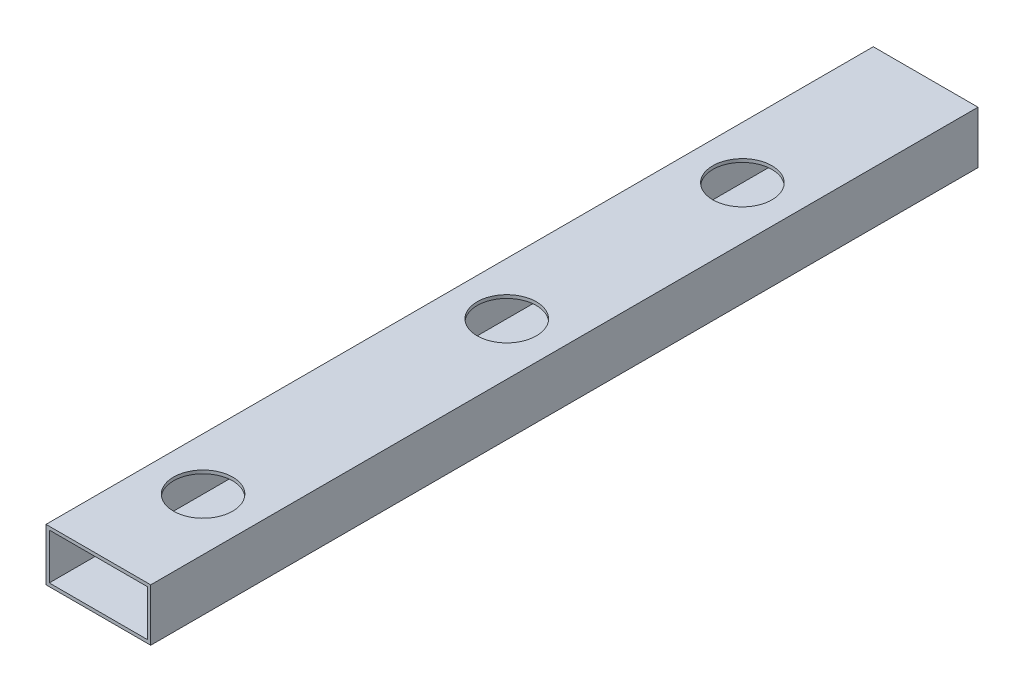
from build123d import *

# Parameters (mm, degrees)
SKETCH1_W           = 50.8
SKETCH1_H           = 25.4
SKETCH1_W_2         = 47.625
SKETCH1_H_2         = 22.225
BOSS_EXTRUDE1_DEPTH = 401.32
SKETCH2_R           = 14.351
CUT_EXTRUDE1_DEPTH  = 406.319062468
SKETCH3_R           = 14.351
CUT_EXTRUDE2_DEPTH  = 406.319062468


with BuildPart() as part:
    # Sketch1 → Boss-Extrude1 (new body)
    with BuildSketch(Plane.XY):
        with Locations((25.4, 12.7)):
            Rectangle(SKETCH1_W, SKETCH1_H)
        with Locations((25.4, 12.7)):
            Rectangle(SKETCH1_W_2, SKETCH1_H_2, mode=Mode.SUBTRACT)
    extrude(amount=BOSS_EXTRUDE1_DEPTH)

    # Sketch2 → Cut-Extrude1 (cut, through all)
    with BuildSketch(Plane(origin=(0, 25.4, 0), x_dir=(1, 0, 0), z_dir=(0, 1, 0))):
        with Locations((25.4, -88.9)):
            Circle(SKETCH2_R)
        with Locations((25.4, -203.2)):
            Circle(SKETCH2_R)
    extrude(amount=-CUT_EXTRUDE1_DEPTH, mode=Mode.SUBTRACT)

    # Sketch3 → Cut-Extrude2 (cut, through all)
    with BuildSketch(Plane(origin=(0, 25.4, 0), x_dir=(1, 0, 0), z_dir=(0, 1, 0))):
        with Locations((25.4, -350.52)):
            Circle(SKETCH3_R)
    extrude(amount=-CUT_EXTRUDE2_DEPTH, mode=Mode.SUBTRACT)


solid = part.part
